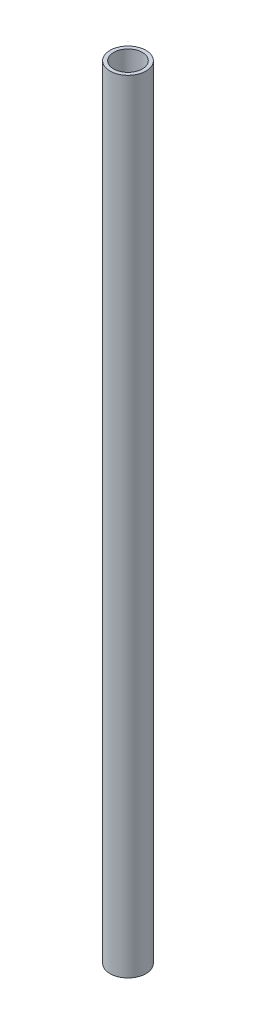
from build123d import *

# Parameters (mm, degrees)
SKETCH1_R           = 17.5
SKETCH1_R_2         = 14
BOSS_EXTRUDE1_DEPTH = 381
CUT_EXTRUDE1_DEPTH  = 12


with BuildPart() as part:
    # Sketch1 → Boss-Extrude1 (new, symmetric)
    with BuildSketch(Plane(origin=(0, 0, 0), x_dir=(1, 0, 0), z_dir=(0, 1, 0))):
        Circle(SKETCH1_R)
        Circle(SKETCH1_R_2, mode=Mode.SUBTRACT)
    extrude(amount=BOSS_EXTRUDE1_DEPTH, both=True)

    # Sketch2 → Cut-Extrude1 (cut)
    with BuildSketch(Plane.XY):
        with BuildLine():
            Line((-3.5, 331), (-3.5, 305.999998493))
            ThreePointArc((-3.5, 305.999998493), (2.49999927, 299.999998924), (8.5, 305.999997034))
            Line((8.5, 305.999997034), (8.5, 331))
            ThreePointArc((8.5, 331), (2.5, 337), (-3.5, 331))
        make_face()
    extrude(amount=-CUT_EXTRUDE1_DEPTH, mode=Mode.SUBTRACT)


solid = part.part
